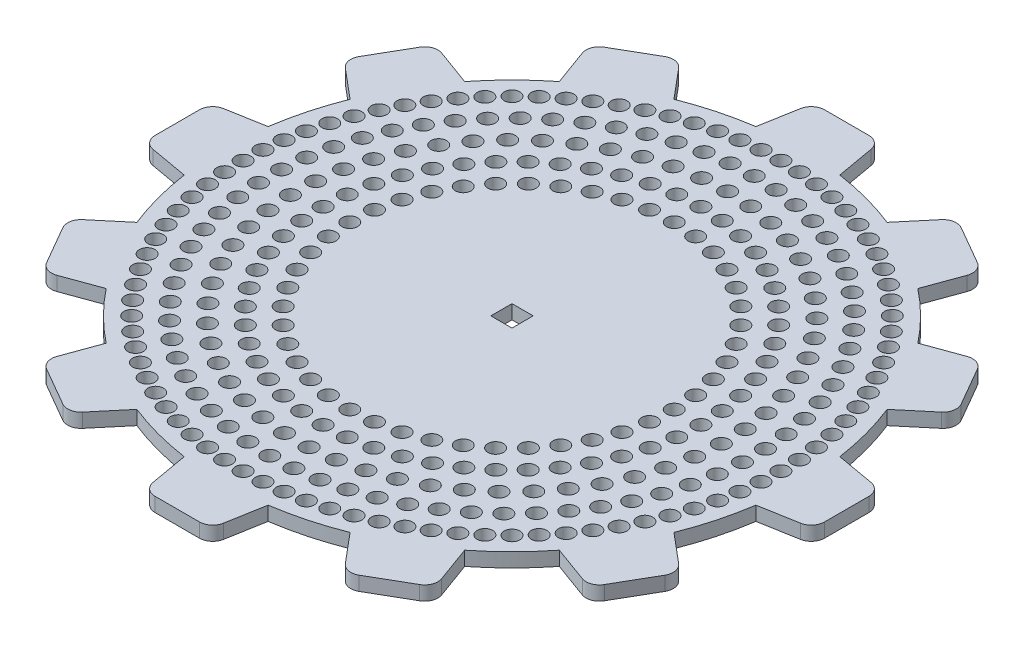
from build123d import *

# Parameters (mm, degrees)
SKETCH1_R           = 130
SKETCH1_R_2         = 3.5
SKETCH1_W           = 9.525
SKETCH1_H           = 9.525
BOSS_EXTRUDE1_DEPTH = 6.35
BOSS_EXTRUDE2_START = -6.35
BOSS_EXTRUDE2_DEPTH = 6.35
FILLET3_R           = 6
FILLET4_R           = 6


with BuildPart() as part:
    # Sketch1 → Boss-Extrude1 (new body)
    with BuildSketch(Plane(origin=(0, 0, 0), x_dir=(1, 0, 0), z_dir=(0, 1, 0))):
        with Locations(Location((0, 0, 0), (0, 0, 270))):
            Circle(SKETCH1_R)
        with Locations(Location((0, 73, 0), (0, 0, 270))):
            Circle(SKETCH1_R_2, mode=Mode.SUBTRACT)
        with Locations(Location((0, 85, 0), (0, 0, 270))):
            Circle(SKETCH1_R_2, mode=Mode.SUBTRACT)
        with Locations(Location((0, 97, 0), (0, 0, 270))):
            Circle(SKETCH1_R_2, mode=Mode.SUBTRACT)
        with Locations(Location((0, 109, 0), (0, 0, 270))):
            Circle(SKETCH1_R_2, mode=Mode.SUBTRACT)
        with Locations(Location((10.36110872, 108.50643956, 0), (0, 0, 270))):
            Circle(SKETCH1_R_2, mode=Mode.SUBTRACT)
        with Locations(Location((20.628385635, 107.030228002, 0), (0, 0, 270))):
            Circle(SKETCH1_R_2, mode=Mode.SUBTRACT)
        with Locations(Location((30.708848696, 104.584734124, 0), (0, 0, 270))):
            Circle(SKETCH1_R_2, mode=Mode.SUBTRACT)
        with Locations(Location((40.511207667, 101.192104699, 0), (0, 0, 270))):
            Circle(SKETCH1_R_2, mode=Mode.SUBTRACT)
        with Locations(Location((49.946690868, 96.883063903, 0), (0, 0, 270))):
            Circle(SKETCH1_R_2, mode=Mode.SUBTRACT)
        with Locations(Location((58.929849103, 91.696635079, 0), (0, 0, 270))):
            Circle(SKETCH1_R_2, mode=Mode.SUBTRACT)
        with Locations(Location((67.379329498, 85.679787327, 0), (0, 0, 270))):
            Circle(SKETCH1_R_2, mode=Mode.SUBTRACT)
        with Locations(Location((75.218612252, 78.887010153, 0), (0, 0, 270))):
            Circle(SKETCH1_R_2, mode=Mode.SUBTRACT)
        with Locations(Location((82.376703605, 71.37982, 0), (0, 0, 270))):
            Circle(SKETCH1_R_2, mode=Mode.SUBTRACT)
        with Locations(Location((88.788778773, 63.226203143, 0), (0, 0, 270))):
            Circle(SKETCH1_R_2, mode=Mode.SUBTRACT)
        with Locations(Location((94.396769013, 54.5, 0), (0, 0, 270))):
            Circle(SKETCH1_R_2, mode=Mode.SUBTRACT)
        with Locations(Location((99.149887494, 45.280236417, 0), (0, 0, 270))):
            Circle(SKETCH1_R_2, mode=Mode.SUBTRACT)
        with Locations(Location((103.00508924, 35.650408002, 0), (0, 0, 270))):
            Circle(SKETCH1_R_2, mode=Mode.SUBTRACT)
        with Locations(Location((105.927460947, 25.697723971, 0), (0, 0, 270))):
            Circle(SKETCH1_R_2, mode=Mode.SUBTRACT)
        with Locations(Location((107.890537165, 15.512317372, 0), (0, 0, 270))):
            Circle(SKETCH1_R_2, mode=Mode.SUBTRACT)
        with Locations(Location((108.876539971, 5.186428825, 0), (0, 0, 270))):
            Circle(SKETCH1_R_2, mode=Mode.SUBTRACT)
        with Locations(Location((108.876539971, -5.186428825, 0), (0, 0, 270))):
            Circle(SKETCH1_R_2, mode=Mode.SUBTRACT)
        with Locations(Location((107.890537165, -15.512317372, 0), (0, 0, 270))):
            Circle(SKETCH1_R_2, mode=Mode.SUBTRACT)
        with Locations(Location((105.927460947, -25.697723971, 0), (0, 0, 270))):
            Circle(SKETCH1_R_2, mode=Mode.SUBTRACT)
        with Locations(Location((103.00508924, -35.650408002, 0), (0, 0, 270))):
            Circle(SKETCH1_R_2, mode=Mode.SUBTRACT)
        with Locations(Location((99.149887494, -45.280236417, 0), (0, 0, 270))):
            Circle(SKETCH1_R_2, mode=Mode.SUBTRACT)
        with Locations(Location((94.396769013, -54.5, 0), (0, 0, 270))):
            Circle(SKETCH1_R_2, mode=Mode.SUBTRACT)
        with Locations(Location((88.788778774, -63.226203143, 0), (0, 0, 270))):
            Circle(SKETCH1_R_2, mode=Mode.SUBTRACT)
        with Locations(Location((82.376703605, -71.37982, 0), (0, 0, 270))):
            Circle(SKETCH1_R_2, mode=Mode.SUBTRACT)
        with Locations(Location((75.218612252, -78.887010153, 0), (0, 0, 270))):
            Circle(SKETCH1_R_2, mode=Mode.SUBTRACT)
        with Locations(Location((67.379329498, -85.679787327, 0), (0, 0, 270))):
            Circle(SKETCH1_R_2, mode=Mode.SUBTRACT)
        with Locations(Location((58.929849103, -91.696635079, 0), (0, 0, 270))):
            Circle(SKETCH1_R_2, mode=Mode.SUBTRACT)
        with Locations(Location((49.946690868, -96.883063903, 0), (0, 0, 270))):
            Circle(SKETCH1_R_2, mode=Mode.SUBTRACT)
        with Locations(Location((40.511207667, -101.192104699, 0), (0, 0, 270))):
            Circle(SKETCH1_R_2, mode=Mode.SUBTRACT)
        with Locations(Location((30.708848696, -104.584734124, 0), (0, 0, 270))):
            Circle(SKETCH1_R_2, mode=Mode.SUBTRACT)
        with Locations(Location((20.628385635, -107.030228002, 0), (0, 0, 270))):
            Circle(SKETCH1_R_2, mode=Mode.SUBTRACT)
        with Locations(Location((10.36110872, -108.50643956, 0), (0, 0, 270))):
            Circle(SKETCH1_R_2, mode=Mode.SUBTRACT)
        with Locations(Location((0, -109, 0), (0, 0, 270))):
            Circle(SKETCH1_R_2, mode=Mode.SUBTRACT)
        with Locations(Location((-10.36110872, -108.50643956, 0), (0, 0, 270))):
            Circle(SKETCH1_R_2, mode=Mode.SUBTRACT)
        with Locations(Location((-20.628385635, -107.030228002, 0), (0, 0, 270))):
            Circle(SKETCH1_R_2, mode=Mode.SUBTRACT)
        with Locations(Location((-30.708848696, -104.584734124, 0), (0, 0, 270))):
            Circle(SKETCH1_R_2, mode=Mode.SUBTRACT)
        with Locations(Location((-40.511207667, -101.192104699, 0), (0, 0, 270))):
            Circle(SKETCH1_R_2, mode=Mode.SUBTRACT)
        with Locations(Location((-49.946690868, -96.883063903, 0), (0, 0, 270))):
            Circle(SKETCH1_R_2, mode=Mode.SUBTRACT)
        with Locations(Location((-58.929849103, -91.696635079, 0), (0, 0, 270))):
            Circle(SKETCH1_R_2, mode=Mode.SUBTRACT)
        with Locations(Location((-67.379329498, -85.679787327, 0), (0, 0, 270))):
            Circle(SKETCH1_R_2, mode=Mode.SUBTRACT)
        with Locations(Location((-75.218612252, -78.887010153, 0), (0, 0, 270))):
            Circle(SKETCH1_R_2, mode=Mode.SUBTRACT)
        with Locations(Location((-82.376703605, -71.37982, 0), (0, 0, 270))):
            Circle(SKETCH1_R_2, mode=Mode.SUBTRACT)
        with Locations(Location((-88.788778773, -63.226203143, 0), (0, 0, 270))):
            Circle(SKETCH1_R_2, mode=Mode.SUBTRACT)
        with Locations(Location((-94.396769012, -54.5, 0), (0, 0, 270))):
            Circle(SKETCH1_R_2, mode=Mode.SUBTRACT)
        with Locations(Location((-99.149887494, -45.280236417, 0), (0, 0, 270))):
            Circle(SKETCH1_R_2, mode=Mode.SUBTRACT)
        with Locations(Location((-103.00508924, -35.650408002, 0), (0, 0, 270))):
            Circle(SKETCH1_R_2, mode=Mode.SUBTRACT)
        with Locations(Location((-105.927460947, -25.697723971, 0), (0, 0, 270))):
            Circle(SKETCH1_R_2, mode=Mode.SUBTRACT)
        with Locations(Location((-107.890537165, -15.512317372, 0), (0, 0, 270))):
            Circle(SKETCH1_R_2, mode=Mode.SUBTRACT)
        with Locations(Location((-108.876539971, -5.186428825, 0), (0, 0, 270))):
            Circle(SKETCH1_R_2, mode=Mode.SUBTRACT)
        with Locations(Location((-108.876539971, 5.186428825, 0), (0, 0, 270))):
            Circle(SKETCH1_R_2, mode=Mode.SUBTRACT)
        with Locations(Location((-107.890537165, 15.512317372, 0), (0, 0, 270))):
            Circle(SKETCH1_R_2, mode=Mode.SUBTRACT)
        with Locations(Location((-105.927460947, 25.697723971, 0), (0, 0, 270))):
            Circle(SKETCH1_R_2, mode=Mode.SUBTRACT)
        with Locations(Location((-103.00508924, 35.650408002, 0), (0, 0, 270))):
            Circle(SKETCH1_R_2, mode=Mode.SUBTRACT)
        with Locations(Location((-99.149887494, 45.280236417, 0), (0, 0, 270))):
            Circle(SKETCH1_R_2, mode=Mode.SUBTRACT)
        with Locations(Location((-94.396769012, 54.5, 0), (0, 0, 270))):
            Circle(SKETCH1_R_2, mode=Mode.SUBTRACT)
        with Locations(Location((-88.788778773, 63.226203143, 0), (0, 0, 270))):
            Circle(SKETCH1_R_2, mode=Mode.SUBTRACT)
        with Locations(Location((-82.376703605, 71.37982, 0), (0, 0, 270))):
            Circle(SKETCH1_R_2, mode=Mode.SUBTRACT)
        with Locations(Location((-75.218612252, 78.887010153, 0), (0, 0, 270))):
            Circle(SKETCH1_R_2, mode=Mode.SUBTRACT)
        with Locations(Location((-67.379329498, 85.679787327, 0), (0, 0, 270))):
            Circle(SKETCH1_R_2, mode=Mode.SUBTRACT)
        with Locations(Location((-58.929849103, 91.696635079, 0), (0, 0, 270))):
            Circle(SKETCH1_R_2, mode=Mode.SUBTRACT)
        with Locations(Location((-49.946690868, 96.883063903, 0), (0, 0, 270))):
            Circle(SKETCH1_R_2, mode=Mode.SUBTRACT)
        with Locations(Location((-40.511207667, 101.192104699, 0), (0, 0, 270))):
            Circle(SKETCH1_R_2, mode=Mode.SUBTRACT)
        with Locations(Location((-30.708848696, 104.584734124, 0), (0, 0, 270))):
            Circle(SKETCH1_R_2, mode=Mode.SUBTRACT)
        with Locations(Location((-20.628385635, 107.030228002, 0), (0, 0, 270))):
            Circle(SKETCH1_R_2, mode=Mode.SUBTRACT)
        with Locations(Location((-10.36110872, 108.50643956, 0), (0, 0, 270))):
            Circle(SKETCH1_R_2, mode=Mode.SUBTRACT)
        with Locations(Location((11.057166759, 96.367728329, 0), (0, 0, 270))):
            Circle(SKETCH1_R_2, mode=Mode.SUBTRACT)
        with Locations(Location((21.97018644, 94.479155943, 0), (0, 0, 270))):
            Circle(SKETCH1_R_2, mode=Mode.SUBTRACT)
        with Locations(Location((32.596791142, 91.358903273, 0), (0, 0, 270))):
            Circle(SKETCH1_R_2, mode=Mode.SUBTRACT)
        with Locations(Location((42.798446821, 87.047647583, 0), (0, 0, 270))):
            Circle(SKETCH1_R_2, mode=Mode.SUBTRACT)
        with Locations(Location((52.442159293, 81.601592685, 0), (0, 0, 270))):
            Circle(SKETCH1_R_2, mode=Mode.SUBTRACT)
        with Locations(Location((61.402208019, 75.091736232, 0), (0, 0, 270))):
            Circle(SKETCH1_R_2, mode=Mode.SUBTRACT)
        with Locations(Location((69.561785062, 67.60294416, 0), (0, 0, 270))):
            Circle(SKETCH1_R_2, mode=Mode.SUBTRACT)
        with Locations(Location((76.814517854, 59.232844325, 0), (0, 0, 270))):
            Circle(SKETCH1_R_2, mode=Mode.SUBTRACT)
        with Locations(Location((83.065855934, 50.090553779, 0), (0, 0, 270))):
            Circle(SKETCH1_R_2, mode=Mode.SUBTRACT)
        with Locations(Location((88.234303549, 40.295256261, 0), (0, 0, 270))):
            Circle(SKETCH1_R_2, mode=Mode.SUBTRACT)
        with Locations(Location((92.252482081, 29.974648454, 0), (0, 0, 270))):
            Circle(SKETCH1_R_2, mode=Mode.SUBTRACT)
        with Locations(Location((95.068008426, 19.263275265, 0), (0, 0, 270))):
            Circle(SKETCH1_R_2, mode=Mode.SUBTRACT)
        with Locations(Location((96.644177894, 8.300775822, 0), (0, 0, 270))):
            Circle(SKETCH1_R_2, mode=Mode.SUBTRACT)
        with Locations(Location((96.960442704, -2.769936927, 0), (0, 0, 270))):
            Circle(SKETCH1_R_2, mode=Mode.SUBTRACT)
        with Locations(Location((96.012679862, -13.804539313, 0), (0, 0, 270))):
            Circle(SKETCH1_R_2, mode=Mode.SUBTRACT)
        with Locations(Location((93.813244906, -24.659178417, 0), (0, 0, 270))):
            Circle(SKETCH1_R_2, mode=Mode.SUBTRACT)
        with Locations(Location((90.390810834, -35.192347419, 0), (0, 0, 270))):
            Circle(SKETCH1_R_2, mode=Mode.SUBTRACT)
        with Locations(Location((85.789994307, -45.266730353, 0), (0, 0, 270))):
            Circle(SKETCH1_R_2, mode=Mode.SUBTRACT)
        with Locations(Location((80.070774005, -54.75099223, 0), (0, 0, 270))):
            Circle(SKETCH1_R_2, mode=Mode.SUBTRACT)
        with Locations(Location((73.307708712, -63.521491193, 0), (0, 0, 270))):
            Circle(SKETCH1_R_2, mode=Mode.SUBTRACT)
        with Locations(Location((65.588965327, -71.463890374, 0), (0, 0, 270))):
            Circle(SKETCH1_R_2, mode=Mode.SUBTRACT)
        with Locations(Location((57.015169472, -78.474648454, 0), (0, 0, 270))):
            Circle(SKETCH1_R_2, mode=Mode.SUBTRACT)
        with Locations(Location((47.698093691, -84.462369481, 0), (0, 0, 270))):
            Circle(SKETCH1_R_2, mode=Mode.SUBTRACT)
        with Locations(Location((37.759200313, -89.348994352, 0), (0, 0, 270))):
            Circle(SKETCH1_R_2, mode=Mode.SUBTRACT)
        with Locations(Location((27.328058014, -93.070818441, 0), (0, 0, 270))):
            Circle(SKETCH1_R_2, mode=Mode.SUBTRACT)
        with Locations(Location((16.540652685, -95.579322077, 0), (0, 0, 270))):
            Circle(SKETCH1_R_2, mode=Mode.SUBTRACT)
        with Locations(Location((5.537614654, -96.841803081, 0), (0, 0, 270))):
            Circle(SKETCH1_R_2, mode=Mode.SUBTRACT)
        with Locations(Location((-5.537614654, -96.841803081, 0), (0, 0, 270))):
            Circle(SKETCH1_R_2, mode=Mode.SUBTRACT)
        with Locations(Location((-16.540652685, -95.579322077, 0), (0, 0, 270))):
            Circle(SKETCH1_R_2, mode=Mode.SUBTRACT)
        with Locations(Location((-27.328058014, -93.070818441, 0), (0, 0, 270))):
            Circle(SKETCH1_R_2, mode=Mode.SUBTRACT)
        with Locations(Location((-37.759200313, -89.348994352, 0), (0, 0, 270))):
            Circle(SKETCH1_R_2, mode=Mode.SUBTRACT)
        with Locations(Location((-47.698093691, -84.462369481, 0), (0, 0, 270))):
            Circle(SKETCH1_R_2, mode=Mode.SUBTRACT)
        with Locations(Location((-57.015169472, -78.474648454, 0), (0, 0, 270))):
            Circle(SKETCH1_R_2, mode=Mode.SUBTRACT)
        with Locations(Location((-65.588965327, -71.463890374, 0), (0, 0, 270))):
            Circle(SKETCH1_R_2, mode=Mode.SUBTRACT)
        with Locations(Location((-73.307708712, -63.521491193, 0), (0, 0, 270))):
            Circle(SKETCH1_R_2, mode=Mode.SUBTRACT)
        with Locations(Location((-80.070774005, -54.75099223, 0), (0, 0, 270))):
            Circle(SKETCH1_R_2, mode=Mode.SUBTRACT)
        with Locations(Location((-85.789994307, -45.266730353, 0), (0, 0, 270))):
            Circle(SKETCH1_R_2, mode=Mode.SUBTRACT)
        with Locations(Location((-90.390810833, -35.192347419, 0), (0, 0, 270))):
            Circle(SKETCH1_R_2, mode=Mode.SUBTRACT)
        with Locations(Location((-93.813244906, -24.659178417, 0), (0, 0, 270))):
            Circle(SKETCH1_R_2, mode=Mode.SUBTRACT)
        with Locations(Location((-96.012679862, -13.804539313, 0), (0, 0, 270))):
            Circle(SKETCH1_R_2, mode=Mode.SUBTRACT)
        with Locations(Location((-96.960442704, -2.769936927, 0), (0, 0, 270))):
            Circle(SKETCH1_R_2, mode=Mode.SUBTRACT)
        with Locations(Location((-96.644177894, 8.300775822, 0), (0, 0, 270))):
            Circle(SKETCH1_R_2, mode=Mode.SUBTRACT)
        with Locations(Location((-95.068008426, 19.263275265, 0), (0, 0, 270))):
            Circle(SKETCH1_R_2, mode=Mode.SUBTRACT)
        with Locations(Location((-92.252482081, 29.974648454, 0), (0, 0, 270))):
            Circle(SKETCH1_R_2, mode=Mode.SUBTRACT)
        with Locations(Location((-88.234303549, 40.295256261, 0), (0, 0, 270))):
            Circle(SKETCH1_R_2, mode=Mode.SUBTRACT)
        with Locations(Location((-83.065855934, 50.090553779, 0), (0, 0, 270))):
            Circle(SKETCH1_R_2, mode=Mode.SUBTRACT)
        with Locations(Location((-76.814517854, 59.232844325, 0), (0, 0, 270))):
            Circle(SKETCH1_R_2, mode=Mode.SUBTRACT)
        with Locations(Location((-69.561785062, 67.60294416, 0), (0, 0, 270))):
            Circle(SKETCH1_R_2, mode=Mode.SUBTRACT)
        with Locations(Location((-61.402208019, 75.091736232, 0), (0, 0, 270))):
            Circle(SKETCH1_R_2, mode=Mode.SUBTRACT)
        with Locations(Location((-52.442159293, 81.601592685, 0), (0, 0, 270))):
            Circle(SKETCH1_R_2, mode=Mode.SUBTRACT)
        with Locations(Location((-42.798446821, 87.047647583, 0), (0, 0, 270))):
            Circle(SKETCH1_R_2, mode=Mode.SUBTRACT)
        with Locations(Location((-32.596791142, 91.358903273, 0), (0, 0, 270))):
            Circle(SKETCH1_R_2, mode=Mode.SUBTRACT)
        with Locations(Location((-21.97018644, 94.479155943, 0), (0, 0, 270))):
            Circle(SKETCH1_R_2, mode=Mode.SUBTRACT)
        with Locations(Location((-11.057166759, 96.367728329, 0), (0, 0, 270))):
            Circle(SKETCH1_R_2, mode=Mode.SUBTRACT)
        with Locations(Location((10.245617822, 84.380254298, 0), (0, 0, 270))):
            Circle(SKETCH1_R_2, mode=Mode.SUBTRACT)
        with Locations(Location((20.341831464, 82.530054481, 0), (0, 0, 270))):
            Circle(SKETCH1_R_2, mode=Mode.SUBTRACT)
        with Locations(Location((30.141415399, 79.476380628, 0), (0, 0, 270))):
            Circle(SKETCH1_R_2, mode=Mode.SUBTRACT)
        with Locations(Location((39.501469624, 75.263762181, 0), (0, 0, 270))):
            Circle(SKETCH1_R_2, mode=Mode.SUBTRACT)
        with Locations(Location((48.285503472, 69.953628601, 0), (0, 0, 270))):
            Circle(SKETCH1_R_2, mode=Mode.SUBTRACT)
        with Locations(Location((56.36542595, 63.623413595, 0), (0, 0, 270))):
            Circle(SKETCH1_R_2, mode=Mode.SUBTRACT)
        with Locations(Location((63.623413595, 56.36542595, 0), (0, 0, 270))):
            Circle(SKETCH1_R_2, mode=Mode.SUBTRACT)
        with Locations(Location((69.953628601, 48.285503472, 0), (0, 0, 270))):
            Circle(SKETCH1_R_2, mode=Mode.SUBTRACT)
        with Locations(Location((75.263762181, 39.501469624, 0), (0, 0, 270))):
            Circle(SKETCH1_R_2, mode=Mode.SUBTRACT)
        with Locations(Location((79.476380628, 30.141415399, 0), (0, 0, 270))):
            Circle(SKETCH1_R_2, mode=Mode.SUBTRACT)
        with Locations(Location((82.530054481, 20.341831464, 0), (0, 0, 270))):
            Circle(SKETCH1_R_2, mode=Mode.SUBTRACT)
        with Locations(Location((84.380254298, 10.245617822, 0), (0, 0, 270))):
            Circle(SKETCH1_R_2, mode=Mode.SUBTRACT)
        with Locations(Location((85, 0, 0), (0, 0, 270))):
            Circle(SKETCH1_R_2, mode=Mode.SUBTRACT)
        with Locations(Location((84.380254298, -10.245617822, 0), (0, 0, 270))):
            Circle(SKETCH1_R_2, mode=Mode.SUBTRACT)
        with Locations(Location((82.530054481, -20.341831464, 0), (0, 0, 270))):
            Circle(SKETCH1_R_2, mode=Mode.SUBTRACT)
        with Locations(Location((79.476380628, -30.141415399, 0), (0, 0, 270))):
            Circle(SKETCH1_R_2, mode=Mode.SUBTRACT)
        with Locations(Location((75.263762181, -39.501469624, 0), (0, 0, 270))):
            Circle(SKETCH1_R_2, mode=Mode.SUBTRACT)
        with Locations(Location((69.953628601, -48.285503472, 0), (0, 0, 270))):
            Circle(SKETCH1_R_2, mode=Mode.SUBTRACT)
        with Locations(Location((63.623413595, -56.36542595, 0), (0, 0, 270))):
            Circle(SKETCH1_R_2, mode=Mode.SUBTRACT)
        with Locations(Location((56.36542595, -63.623413595, 0), (0, 0, 270))):
            Circle(SKETCH1_R_2, mode=Mode.SUBTRACT)
        with Locations(Location((48.285503472, -69.953628601, 0), (0, 0, 270))):
            Circle(SKETCH1_R_2, mode=Mode.SUBTRACT)
        with Locations(Location((39.501469624, -75.263762181, 0), (0, 0, 270))):
            Circle(SKETCH1_R_2, mode=Mode.SUBTRACT)
        with Locations(Location((30.141415399, -79.476380628, 0), (0, 0, 270))):
            Circle(SKETCH1_R_2, mode=Mode.SUBTRACT)
        with Locations(Location((20.341831464, -82.530054481, 0), (0, 0, 270))):
            Circle(SKETCH1_R_2, mode=Mode.SUBTRACT)
        with Locations(Location((10.245617822, -84.380254298, 0), (0, 0, 270))):
            Circle(SKETCH1_R_2, mode=Mode.SUBTRACT)
        with Locations(Location((0, -85, 0), (0, 0, 270))):
            Circle(SKETCH1_R_2, mode=Mode.SUBTRACT)
        with Locations(Location((-10.245617822, -84.380254298, 0), (0, 0, 270))):
            Circle(SKETCH1_R_2, mode=Mode.SUBTRACT)
        with Locations(Location((-20.341831464, -82.530054481, 0), (0, 0, 270))):
            Circle(SKETCH1_R_2, mode=Mode.SUBTRACT)
        with Locations(Location((-30.141415399, -79.476380628, 0), (0, 0, 270))):
            Circle(SKETCH1_R_2, mode=Mode.SUBTRACT)
        with Locations(Location((-39.501469624, -75.263762181, 0), (0, 0, 270))):
            Circle(SKETCH1_R_2, mode=Mode.SUBTRACT)
        with Locations(Location((-48.285503472, -69.953628601, 0), (0, 0, 270))):
            Circle(SKETCH1_R_2, mode=Mode.SUBTRACT)
        with Locations(Location((-56.36542595, -63.623413595, 0), (0, 0, 270))):
            Circle(SKETCH1_R_2, mode=Mode.SUBTRACT)
        with Locations(Location((-63.623413595, -56.36542595, 0), (0, 0, 270))):
            Circle(SKETCH1_R_2, mode=Mode.SUBTRACT)
        with Locations(Location((-69.953628601, -48.285503472, 0), (0, 0, 270))):
            Circle(SKETCH1_R_2, mode=Mode.SUBTRACT)
        with Locations(Location((-75.263762181, -39.501469624, 0), (0, 0, 270))):
            Circle(SKETCH1_R_2, mode=Mode.SUBTRACT)
        with Locations(Location((-79.476380628, -30.141415399, 0), (0, 0, 270))):
            Circle(SKETCH1_R_2, mode=Mode.SUBTRACT)
        with Locations(Location((-82.530054481, -20.341831464, 0), (0, 0, 270))):
            Circle(SKETCH1_R_2, mode=Mode.SUBTRACT)
        with Locations(Location((-84.380254298, -10.245617822, 0), (0, 0, 270))):
            Circle(SKETCH1_R_2, mode=Mode.SUBTRACT)
        with Locations(Location((-85, 0, 0), (0, 0, 270))):
            Circle(SKETCH1_R_2, mode=Mode.SUBTRACT)
        with Locations(Location((-84.380254298, 10.245617822, 0), (0, 0, 270))):
            Circle(SKETCH1_R_2, mode=Mode.SUBTRACT)
        with Locations(Location((-82.530054481, 20.341831464, 0), (0, 0, 270))):
            Circle(SKETCH1_R_2, mode=Mode.SUBTRACT)
        with Locations(Location((-79.476380628, 30.141415399, 0), (0, 0, 270))):
            Circle(SKETCH1_R_2, mode=Mode.SUBTRACT)
        with Locations(Location((-75.263762181, 39.501469624, 0), (0, 0, 270))):
            Circle(SKETCH1_R_2, mode=Mode.SUBTRACT)
        with Locations(Location((-69.953628601, 48.285503472, 0), (0, 0, 270))):
            Circle(SKETCH1_R_2, mode=Mode.SUBTRACT)
        with Locations(Location((-63.623413595, 56.36542595, 0), (0, 0, 270))):
            Circle(SKETCH1_R_2, mode=Mode.SUBTRACT)
        with Locations(Location((-56.36542595, 63.623413595, 0), (0, 0, 270))):
            Circle(SKETCH1_R_2, mode=Mode.SUBTRACT)
        with Locations(Location((-48.285503472, 69.953628601, 0), (0, 0, 270))):
            Circle(SKETCH1_R_2, mode=Mode.SUBTRACT)
        with Locations(Location((-39.501469624, 75.263762181, 0), (0, 0, 270))):
            Circle(SKETCH1_R_2, mode=Mode.SUBTRACT)
        with Locations(Location((-30.141415399, 79.476380628, 0), (0, 0, 270))):
            Circle(SKETCH1_R_2, mode=Mode.SUBTRACT)
        with Locations(Location((-20.341831464, 82.530054481, 0), (0, 0, 270))):
            Circle(SKETCH1_R_2, mode=Mode.SUBTRACT)
        with Locations(Location((-10.245617822, 84.380254298, 0), (0, 0, 270))):
            Circle(SKETCH1_R_2, mode=Mode.SUBTRACT)
        with Locations(Location((10.388983194, 72.256965257, 0), (0, 0, 270))):
            Circle(SKETCH1_R_2, mode=Mode.SUBTRACT)
        with Locations(Location((20.566476649, 70.042987074, 0), (0, 0, 270))):
            Circle(SKETCH1_R_2, mode=Mode.SUBTRACT)
        with Locations(Location((30.325295949, 66.403135661, 0), (0, 0, 270))):
            Circle(SKETCH1_R_2, mode=Mode.SUBTRACT)
        with Locations(Location((39.466779674, 61.411507897, 0), (0, 0, 270))):
            Circle(SKETCH1_R_2, mode=Mode.SUBTRACT)
        with Locations(Location((47.804833578, 55.169718928, 0), (0, 0, 270))):
            Circle(SKETCH1_R_2, mode=Mode.SUBTRACT)
        with Locations(Location((55.169718928, 47.804833578, 0), (0, 0, 270))):
            Circle(SKETCH1_R_2, mode=Mode.SUBTRACT)
        with Locations(Location((61.411507897, 39.466779674, 0), (0, 0, 270))):
            Circle(SKETCH1_R_2, mode=Mode.SUBTRACT)
        with Locations(Location((66.403135661, 30.325295949, 0), (0, 0, 270))):
            Circle(SKETCH1_R_2, mode=Mode.SUBTRACT)
        with Locations(Location((70.042987074, 20.566476649, 0), (0, 0, 270))):
            Circle(SKETCH1_R_2, mode=Mode.SUBTRACT)
        with Locations(Location((72.256965257, 10.388983194, 0), (0, 0, 270))):
            Circle(SKETCH1_R_2, mode=Mode.SUBTRACT)
        with Locations(Location((73, 0, 0), (0, 0, 270))):
            Circle(SKETCH1_R_2, mode=Mode.SUBTRACT)
        with Locations(Location((72.256965257, -10.388983194, 0), (0, 0, 270))):
            Circle(SKETCH1_R_2, mode=Mode.SUBTRACT)
        with Locations(Location((70.042987074, -20.566476649, 0), (0, 0, 270))):
            Circle(SKETCH1_R_2, mode=Mode.SUBTRACT)
        with Locations(Location((66.403135661, -30.325295949, 0), (0, 0, 270))):
            Circle(SKETCH1_R_2, mode=Mode.SUBTRACT)
        with Locations(Location((61.411507897, -39.466779674, 0), (0, 0, 270))):
            Circle(SKETCH1_R_2, mode=Mode.SUBTRACT)
        with Locations(Location((55.169718928, -47.804833578, 0), (0, 0, 270))):
            Circle(SKETCH1_R_2, mode=Mode.SUBTRACT)
        with Locations(Location((47.804833578, -55.169718928, 0), (0, 0, 270))):
            Circle(SKETCH1_R_2, mode=Mode.SUBTRACT)
        with Locations(Location((39.466779674, -61.411507897, 0), (0, 0, 270))):
            Circle(SKETCH1_R_2, mode=Mode.SUBTRACT)
        with Locations(Location((30.325295949, -66.403135661, 0), (0, 0, 270))):
            Circle(SKETCH1_R_2, mode=Mode.SUBTRACT)
        with Locations(Location((20.566476649, -70.042987074, 0), (0, 0, 270))):
            Circle(SKETCH1_R_2, mode=Mode.SUBTRACT)
        with Locations(Location((10.388983194, -72.256965257, 0), (0, 0, 270))):
            Circle(SKETCH1_R_2, mode=Mode.SUBTRACT)
        with Locations(Location((0, -73, 0), (0, 0, 270))):
            Circle(SKETCH1_R_2, mode=Mode.SUBTRACT)
        with Locations(Location((-10.388983194, -72.256965257, 0), (0, 0, 270))):
            Circle(SKETCH1_R_2, mode=Mode.SUBTRACT)
        with Locations(Location((-20.566476649, -70.042987074, 0), (0, 0, 270))):
            Circle(SKETCH1_R_2, mode=Mode.SUBTRACT)
        with Locations(Location((-30.325295949, -66.403135661, 0), (0, 0, 270))):
            Circle(SKETCH1_R_2, mode=Mode.SUBTRACT)
        with Locations(Location((-39.466779674, -61.411507897, 0), (0, 0, 270))):
            Circle(SKETCH1_R_2, mode=Mode.SUBTRACT)
        with Locations(Location((-47.804833578, -55.169718928, 0), (0, 0, 270))):
            Circle(SKETCH1_R_2, mode=Mode.SUBTRACT)
        with Locations(Location((-55.169718928, -47.804833578, 0), (0, 0, 270))):
            Circle(SKETCH1_R_2, mode=Mode.SUBTRACT)
        with Locations(Location((-61.411507897, -39.466779674, 0), (0, 0, 270))):
            Circle(SKETCH1_R_2, mode=Mode.SUBTRACT)
        with Locations(Location((-66.403135661, -30.325295949, 0), (0, 0, 270))):
            Circle(SKETCH1_R_2, mode=Mode.SUBTRACT)
        with Locations(Location((-70.042987074, -20.566476649, 0), (0, 0, 270))):
            Circle(SKETCH1_R_2, mode=Mode.SUBTRACT)
        with Locations(Location((-72.256965257, -10.388983194, 0), (0, 0, 270))):
            Circle(SKETCH1_R_2, mode=Mode.SUBTRACT)
        with Locations(Location((-73, 0, 0), (0, 0, 270))):
            Circle(SKETCH1_R_2, mode=Mode.SUBTRACT)
        with Locations(Location((-72.256965257, 10.388983194, 0), (0, 0, 270))):
            Circle(SKETCH1_R_2, mode=Mode.SUBTRACT)
        with Locations(Location((-70.042987074, 20.566476649, 0), (0, 0, 270))):
            Circle(SKETCH1_R_2, mode=Mode.SUBTRACT)
        with Locations(Location((-66.403135661, 30.325295949, 0), (0, 0, 270))):
            Circle(SKETCH1_R_2, mode=Mode.SUBTRACT)
        with Locations(Location((-61.411507897, 39.466779674, 0), (0, 0, 270))):
            Circle(SKETCH1_R_2, mode=Mode.SUBTRACT)
        with Locations(Location((-55.169718928, 47.804833578, 0), (0, 0, 270))):
            Circle(SKETCH1_R_2, mode=Mode.SUBTRACT)
        with Locations(Location((-47.804833578, 55.169718928, 0), (0, 0, 270))):
            Circle(SKETCH1_R_2, mode=Mode.SUBTRACT)
        with Locations(Location((-39.466779674, 61.411507897, 0), (0, 0, 270))):
            Circle(SKETCH1_R_2, mode=Mode.SUBTRACT)
        with Locations(Location((-30.325295949, 66.403135661, 0), (0, 0, 270))):
            Circle(SKETCH1_R_2, mode=Mode.SUBTRACT)
        with Locations(Location((-20.566476649, 70.042987074, 0), (0, 0, 270))):
            Circle(SKETCH1_R_2, mode=Mode.SUBTRACT)
        with Locations(Location((-10.388983194, 72.256965257, 0), (0, 0, 270))):
            Circle(SKETCH1_R_2, mode=Mode.SUBTRACT)
        with Locations(Location((0, 121, 0), (0, 0, 270))):
            Circle(SKETCH1_R_2, mode=Mode.SUBTRACT)
        with Locations(Location((8.632041167, 120.691705868, 0), (0, 0, 270))):
            Circle(SKETCH1_R_2, mode=Mode.SUBTRACT)
        with Locations(Location((17.220095431, 119.768394468, 0), (0, 0, 270))):
            Circle(SKETCH1_R_2, mode=Mode.SUBTRACT)
        with Locations(Location((25.720400036, 118.234770783, 0), (0, 0, 270))):
            Circle(SKETCH1_R_2, mode=Mode.SUBTRACT)
        with Locations(Location((34.089639378, 116.098649807, 0), (0, 0, 270))):
            Circle(SKETCH1_R_2, mode=Mode.SUBTRACT)
        with Locations(Location((42.285165731, 113.370916725, 0), (0, 0, 270))):
            Circle(SKETCH1_R_2, mode=Mode.SUBTRACT)
        with Locations(Location((50.265216573, 110.065471438, 0), (0, 0, 270))):
            Circle(SKETCH1_R_2, mode=Mode.SUBTRACT)
        with Locations(Location((57.989127393, 106.199157738, 0), (0, 0, 270))):
            Circle(SKETCH1_R_2, mode=Mode.SUBTRACT)
        with Locations(Location((65.417538912, 101.791677473, 0), (0, 0, 270))):
            Circle(SKETCH1_R_2, mode=Mode.SUBTRACT)
        with Locations(Location((72.512597648, 96.865490152, 0), (0, 0, 270))):
            Circle(SKETCH1_R_2, mode=Mode.SUBTRACT)
        with Locations(Location((79.238148807, 91.445698497, 0), (0, 0, 270))):
            Circle(SKETCH1_R_2, mode=Mode.SUBTRACT)
        with Locations(Location((85.559920524, 85.559920524, 0), (0, 0, 270))):
            Circle(SKETCH1_R_2, mode=Mode.SUBTRACT)
        with Locations(Location((91.445698497, 79.238148807, 0), (0, 0, 270))):
            Circle(SKETCH1_R_2, mode=Mode.SUBTRACT)
        with Locations(Location((96.865490152, 72.512597648, 0), (0, 0, 270))):
            Circle(SKETCH1_R_2, mode=Mode.SUBTRACT)
        with Locations(Location((101.791677473, 65.417538912, 0), (0, 0, 270))):
            Circle(SKETCH1_R_2, mode=Mode.SUBTRACT)
        with Locations(Location((106.199157738, 57.989127393, 0), (0, 0, 270))):
            Circle(SKETCH1_R_2, mode=Mode.SUBTRACT)
        with Locations(Location((110.065471438, 50.265216573, 0), (0, 0, 270))):
            Circle(SKETCH1_R_2, mode=Mode.SUBTRACT)
        with Locations(Location((113.370916725, 42.285165731, 0), (0, 0, 270))):
            Circle(SKETCH1_R_2, mode=Mode.SUBTRACT)
        with Locations(Location((116.098649807, 34.089639378, 0), (0, 0, 270))):
            Circle(SKETCH1_R_2, mode=Mode.SUBTRACT)
        with Locations(Location((118.234770783, 25.720400036, 0), (0, 0, 270))):
            Circle(SKETCH1_R_2, mode=Mode.SUBTRACT)
        with Locations(Location((119.768394468, 17.220095431, 0), (0, 0, 270))):
            Circle(SKETCH1_R_2, mode=Mode.SUBTRACT)
        with Locations(Location((120.691705868, 8.632041167, 0), (0, 0, 270))):
            Circle(SKETCH1_R_2, mode=Mode.SUBTRACT)
        with Locations(Location((121, 0, 0), (0, 0, 270))):
            Circle(SKETCH1_R_2, mode=Mode.SUBTRACT)
        with Locations(Location((120.691705868, -8.632041167, 0), (0, 0, 270))):
            Circle(SKETCH1_R_2, mode=Mode.SUBTRACT)
        with Locations(Location((119.768394468, -17.220095431, 0), (0, 0, 270))):
            Circle(SKETCH1_R_2, mode=Mode.SUBTRACT)
        with Locations(Location((118.234770783, -25.720400036, 0), (0, 0, 270))):
            Circle(SKETCH1_R_2, mode=Mode.SUBTRACT)
        with Locations(Location((116.098649807, -34.089639378, 0), (0, 0, 270))):
            Circle(SKETCH1_R_2, mode=Mode.SUBTRACT)
        with Locations(Location((113.370916725, -42.285165731, 0), (0, 0, 270))):
            Circle(SKETCH1_R_2, mode=Mode.SUBTRACT)
        with Locations(Location((110.065471438, -50.265216573, 0), (0, 0, 270))):
            Circle(SKETCH1_R_2, mode=Mode.SUBTRACT)
        with Locations(Location((106.199157738, -57.989127393, 0), (0, 0, 270))):
            Circle(SKETCH1_R_2, mode=Mode.SUBTRACT)
        with Locations(Location((101.791677473, -65.417538912, 0), (0, 0, 270))):
            Circle(SKETCH1_R_2, mode=Mode.SUBTRACT)
        with Locations(Location((96.865490152, -72.512597648, 0), (0, 0, 270))):
            Circle(SKETCH1_R_2, mode=Mode.SUBTRACT)
        with Locations(Location((91.445698497, -79.238148807, 0), (0, 0, 270))):
            Circle(SKETCH1_R_2, mode=Mode.SUBTRACT)
        with Locations(Location((85.559920524, -85.559920524, 0), (0, 0, 270))):
            Circle(SKETCH1_R_2, mode=Mode.SUBTRACT)
        with Locations(Location((79.238148807, -91.445698497, 0), (0, 0, 270))):
            Circle(SKETCH1_R_2, mode=Mode.SUBTRACT)
        with Locations(Location((72.512597648, -96.865490152, 0), (0, 0, 270))):
            Circle(SKETCH1_R_2, mode=Mode.SUBTRACT)
        with Locations(Location((65.417538912, -101.791677473, 0), (0, 0, 270))):
            Circle(SKETCH1_R_2, mode=Mode.SUBTRACT)
        with Locations(Location((57.989127393, -106.199157738, 0), (0, 0, 270))):
            Circle(SKETCH1_R_2, mode=Mode.SUBTRACT)
        with Locations(Location((50.265216573, -110.065471438, 0), (0, 0, 270))):
            Circle(SKETCH1_R_2, mode=Mode.SUBTRACT)
        with Locations(Location((42.285165732, -113.370916725, 0), (0, 0, 270))):
            Circle(SKETCH1_R_2, mode=Mode.SUBTRACT)
        with Locations(Location((34.089639378, -116.098649807, 0), (0, 0, 270))):
            Circle(SKETCH1_R_2, mode=Mode.SUBTRACT)
        with Locations(Location((25.720400036, -118.234770783, 0), (0, 0, 270))):
            Circle(SKETCH1_R_2, mode=Mode.SUBTRACT)
        with Locations(Location((17.220095431, -119.768394468, 0), (0, 0, 270))):
            Circle(SKETCH1_R_2, mode=Mode.SUBTRACT)
        with Locations(Location((8.632041167, -120.691705868, 0), (0, 0, 270))):
            Circle(SKETCH1_R_2, mode=Mode.SUBTRACT)
        with Locations(Location((0, -121, 0), (0, 0, 270))):
            Circle(SKETCH1_R_2, mode=Mode.SUBTRACT)
        with Locations(Location((-8.632041167, -120.691705868, 0), (0, 0, 270))):
            Circle(SKETCH1_R_2, mode=Mode.SUBTRACT)
        with Locations(Location((-17.220095431, -119.768394468, 0), (0, 0, 270))):
            Circle(SKETCH1_R_2, mode=Mode.SUBTRACT)
        with Locations(Location((-25.720400036, -118.234770783, 0), (0, 0, 270))):
            Circle(SKETCH1_R_2, mode=Mode.SUBTRACT)
        with Locations(Location((-34.089639378, -116.098649807, 0), (0, 0, 270))):
            Circle(SKETCH1_R_2, mode=Mode.SUBTRACT)
        with Locations(Location((-42.285165731, -113.370916725, 0), (0, 0, 270))):
            Circle(SKETCH1_R_2, mode=Mode.SUBTRACT)
        with Locations(Location((-50.265216573, -110.065471438, 0), (0, 0, 270))):
            Circle(SKETCH1_R_2, mode=Mode.SUBTRACT)
        with Locations(Location((-57.989127393, -106.199157738, 0), (0, 0, 270))):
            Circle(SKETCH1_R_2, mode=Mode.SUBTRACT)
        with Locations(Location((-65.417538912, -101.791677473, 0), (0, 0, 270))):
            Circle(SKETCH1_R_2, mode=Mode.SUBTRACT)
        with Locations(Location((-72.512597648, -96.865490152, 0), (0, 0, 270))):
            Circle(SKETCH1_R_2, mode=Mode.SUBTRACT)
        with Locations(Location((-79.238148807, -91.445698497, 0), (0, 0, 270))):
            Circle(SKETCH1_R_2, mode=Mode.SUBTRACT)
        with Locations(Location((-85.559920524, -85.559920524, 0), (0, 0, 270))):
            Circle(SKETCH1_R_2, mode=Mode.SUBTRACT)
        with Locations(Location((-91.445698497, -79.238148807, 0), (0, 0, 270))):
            Circle(SKETCH1_R_2, mode=Mode.SUBTRACT)
        with Locations(Location((-96.865490152, -72.512597648, 0), (0, 0, 270))):
            Circle(SKETCH1_R_2, mode=Mode.SUBTRACT)
        with Locations(Location((-101.791677473, -65.417538912, 0), (0, 0, 270))):
            Circle(SKETCH1_R_2, mode=Mode.SUBTRACT)
        with Locations(Location((-106.199157738, -57.989127393, 0), (0, 0, 270))):
            Circle(SKETCH1_R_2, mode=Mode.SUBTRACT)
        with Locations(Location((-110.065471438, -50.265216573, 0), (0, 0, 270))):
            Circle(SKETCH1_R_2, mode=Mode.SUBTRACT)
        with Locations(Location((-113.370916725, -42.285165731, 0), (0, 0, 270))):
            Circle(SKETCH1_R_2, mode=Mode.SUBTRACT)
        with Locations(Location((-116.098649807, -34.089639378, 0), (0, 0, 270))):
            Circle(SKETCH1_R_2, mode=Mode.SUBTRACT)
        with Locations(Location((-118.234770783, -25.720400036, 0), (0, 0, 270))):
            Circle(SKETCH1_R_2, mode=Mode.SUBTRACT)
        with Locations(Location((-119.768394468, -17.220095431, 0), (0, 0, 270))):
            Circle(SKETCH1_R_2, mode=Mode.SUBTRACT)
        with Locations(Location((-120.691705868, -8.632041167, 0), (0, 0, 270))):
            Circle(SKETCH1_R_2, mode=Mode.SUBTRACT)
        with Locations(Location((-121, 0, 0), (0, 0, 270))):
            Circle(SKETCH1_R_2, mode=Mode.SUBTRACT)
        with Locations(Location((-120.691705868, 8.632041167, 0), (0, 0, 270))):
            Circle(SKETCH1_R_2, mode=Mode.SUBTRACT)
        with Locations(Location((-119.768394468, 17.220095431, 0), (0, 0, 270))):
            Circle(SKETCH1_R_2, mode=Mode.SUBTRACT)
        with Locations(Location((-118.234770783, 25.720400036, 0), (0, 0, 270))):
            Circle(SKETCH1_R_2, mode=Mode.SUBTRACT)
        with Locations(Location((-116.098649807, 34.089639378, 0), (0, 0, 270))):
            Circle(SKETCH1_R_2, mode=Mode.SUBTRACT)
        with Locations(Location((-113.370916725, 42.285165731, 0), (0, 0, 270))):
            Circle(SKETCH1_R_2, mode=Mode.SUBTRACT)
        with Locations(Location((-110.065471438, 50.265216573, 0), (0, 0, 270))):
            Circle(SKETCH1_R_2, mode=Mode.SUBTRACT)
        with Locations(Location((-106.199157738, 57.989127393, 0), (0, 0, 270))):
            Circle(SKETCH1_R_2, mode=Mode.SUBTRACT)
        with Locations(Location((-101.791677473, 65.417538912, 0), (0, 0, 270))):
            Circle(SKETCH1_R_2, mode=Mode.SUBTRACT)
        with Locations(Location((-96.865490152, 72.512597648, 0), (0, 0, 270))):
            Circle(SKETCH1_R_2, mode=Mode.SUBTRACT)
        with Locations(Location((-91.445698497, 79.238148807, 0), (0, 0, 270))):
            Circle(SKETCH1_R_2, mode=Mode.SUBTRACT)
        with Locations(Location((-85.559920524, 85.559920524, 0), (0, 0, 270))):
            Circle(SKETCH1_R_2, mode=Mode.SUBTRACT)
        with Locations(Location((-79.238148807, 91.445698497, 0), (0, 0, 270))):
            Circle(SKETCH1_R_2, mode=Mode.SUBTRACT)
        with Locations(Location((-72.512597648, 96.865490152, 0), (0, 0, 270))):
            Circle(SKETCH1_R_2, mode=Mode.SUBTRACT)
        with Locations(Location((-65.417538912, 101.791677473, 0), (0, 0, 270))):
            Circle(SKETCH1_R_2, mode=Mode.SUBTRACT)
        with Locations(Location((-57.989127393, 106.199157738, 0), (0, 0, 270))):
            Circle(SKETCH1_R_2, mode=Mode.SUBTRACT)
        with Locations(Location((-50.265216573, 110.065471438, 0), (0, 0, 270))):
            Circle(SKETCH1_R_2, mode=Mode.SUBTRACT)
        with Locations(Location((-42.285165731, 113.370916725, 0), (0, 0, 270))):
            Circle(SKETCH1_R_2, mode=Mode.SUBTRACT)
        with Locations(Location((-34.089639378, 116.098649807, 0), (0, 0, 270))):
            Circle(SKETCH1_R_2, mode=Mode.SUBTRACT)
        with Locations(Location((-25.720400036, 118.234770783, 0), (0, 0, 270))):
            Circle(SKETCH1_R_2, mode=Mode.SUBTRACT)
        with Locations(Location((-17.220095431, 119.768394468, 0), (0, 0, 270))):
            Circle(SKETCH1_R_2, mode=Mode.SUBTRACT)
        with Locations(Location((-8.632041167, 120.691705868, 0), (0, 0, 270))):
            Circle(SKETCH1_R_2, mode=Mode.SUBTRACT)
        Rectangle(SKETCH1_W, SKETCH1_H, mode=Mode.SUBTRACT)
    extrude(amount=BOSS_EXTRUDE1_DEPTH)

    # Sketch2 → Boss-Extrude2 (add)
    with BuildSketch(Plane(origin=(0, 6.35, 0), x_dir=(1, 0, 0), z_dir=(0, 1, 0)).offset(BOSS_EXTRUDE2_START)):
        with BuildLine():
            Line((0, 150.621833488), (15, 150.621833488))
            Line((15, 150.621833488), (18.879193576, 128.621833488))
            ThreePointArc((18.879193576, 128.621833488), (0, 130), (-18.879193576, 128.621833488))
            Line((-18.879193576, 128.621833488), (-15, 150.621833488))
            Line((-15, 150.621833488), (0, 150.621833488))
        make_face()
        with BuildLine():
            Line((62.320535687, 137.942334166), (47.961055505, 120.82937207))
            ThreePointArc((47.961055505, 120.82937207), (65, 112.583302492), (80.660777984, 101.950178495))
            Line((80.660777984, 101.950178495), (88.301297801, 122.942334166))
            Line((88.301297801, 122.942334166), (75.310916744, 130.442334166))
            Line((75.310916744, 130.442334166), (62.320535687, 137.942334166))
        make_face()
        with BuildLine():
            Line((122.942334166, 88.301297801), (101.950178495, 80.660777984))
            ThreePointArc((101.950178495, 80.660777984), (112.583302492, 65), (120.82937207, 47.961055505))
            Line((120.82937207, 47.961055505), (137.942334166, 62.320535687))
            Line((137.942334166, 62.320535687), (130.442334166, 75.310916744))
            Line((130.442334166, 75.310916744), (122.942334166, 88.301297801))
        make_face()
        with BuildLine():
            Line((150.621833488, 15), (128.621833488, 18.879193576))
            ThreePointArc((128.621833488, 18.879193576), (130, 0), (128.621833488, -18.879193576))
            Line((128.621833488, -18.879193576), (150.621833488, -15))
            Line((150.621833488, -15), (150.621833488, 0))
            Line((150.621833488, 0), (150.621833488, 15))
        make_face()
        with BuildLine():
            Line((137.942334166, -62.320535687), (120.82937207, -47.961055505))
            ThreePointArc((120.82937207, -47.961055505), (112.583302492, -65), (101.950178495, -80.660777984))
            Line((101.950178495, -80.660777984), (122.942334166, -88.301297801))
            Line((122.942334166, -88.301297801), (130.442334166, -75.310916744))
            Line((130.442334166, -75.310916744), (137.942334166, -62.320535687))
        make_face()
        with BuildLine():
            Line((88.301297801, -122.942334166), (80.660777984, -101.950178495))
            ThreePointArc((80.660777984, -101.950178495), (65, -112.583302492), (47.961055505, -120.82937207))
            Line((47.961055505, -120.82937207), (62.320535687, -137.942334166))
            Line((62.320535687, -137.942334166), (75.310916744, -130.442334166))
            Line((75.310916744, -130.442334166), (88.301297801, -122.942334166))
        make_face()
        with BuildLine():
            Line((15, -150.621833488), (18.879193576, -128.621833488))
            ThreePointArc((18.879193576, -128.621833488), (0, -130), (-18.879193576, -128.621833488))
            Line((-18.879193576, -128.621833488), (-15, -150.621833488))
            Line((-15, -150.621833488), (0, -150.621833488))
            Line((0, -150.621833488), (15, -150.621833488))
        make_face()
        with BuildLine():
            Line((-62.320535687, -137.942334166), (-47.961055505, -120.82937207))
            ThreePointArc((-47.961055505, -120.82937207), (-65, -112.583302492), (-80.660777984, -101.950178495))
            Line((-80.660777984, -101.950178495), (-88.301297801, -122.942334166))
            Line((-88.301297801, -122.942334166), (-75.310916744, -130.442334166))
            Line((-75.310916744, -130.442334166), (-62.320535687, -137.942334166))
        make_face()
        with BuildLine():
            Line((-122.942334166, -88.301297801), (-101.950178495, -80.660777984))
            ThreePointArc((-101.950178495, -80.660777984), (-112.583302492, -65), (-120.82937207, -47.961055505))
            Line((-120.82937207, -47.961055505), (-137.942334166, -62.320535687))
            Line((-137.942334166, -62.320535687), (-130.442334166, -75.310916744))
            Line((-130.442334166, -75.310916744), (-122.942334166, -88.301297801))
        make_face()
        with BuildLine():
            Line((-150.621833488, -15), (-128.621833488, -18.879193576))
            ThreePointArc((-128.621833488, -18.879193576), (-130, 0), (-128.621833488, 18.879193576))
            Line((-128.621833488, 18.879193576), (-150.621833488, 15))
            Line((-150.621833488, 15), (-150.621833488, 0))
            Line((-150.621833488, 0), (-150.621833488, -15))
        make_face()
        with BuildLine():
            Line((-137.942334166, 62.320535687), (-120.82937207, 47.961055505))
            ThreePointArc((-120.82937207, 47.961055505), (-112.583302492, 65), (-101.950178495, 80.660777984))
            Line((-101.950178495, 80.660777984), (-122.942334166, 88.301297801))
            Line((-122.942334166, 88.301297801), (-130.442334166, 75.310916744))
            Line((-130.442334166, 75.310916744), (-137.942334166, 62.320535687))
        make_face()
        with BuildLine():
            Line((-88.301297801, 122.942334166), (-80.660777984, 101.950178495))
            ThreePointArc((-80.660777984, 101.950178495), (-65, 112.583302492), (-47.961055505, 120.82937207))
            Line((-47.961055505, 120.82937207), (-62.320535687, 137.942334166))
            Line((-62.320535687, 137.942334166), (-75.310916744, 130.442334166))
            Line((-75.310916744, 130.442334166), (-88.301297801, 122.942334166))
        make_face()
    extrude(amount=BOSS_EXTRUDE2_DEPTH)

    # Fillet3
    fillet3_edges = [part.edges().sort_by_distance(p)[0] for p in [
        (-15, 3.175, -150.621833488),
        (15, 3.175, -150.621833488),
        (62.320535687, 3.175, -137.942334166),
        (88.301297801, 3.175, -122.942334166),
        (137.942334166, 3.175, -62.320535687),
        (150.621833488, 3.175, -15),
        (150.621833488, 3.175, 15),
        (137.942334166, 3.175, 62.320535687),
        (122.942334166, 3.175, 88.301297801),
        (88.301297801, 3.175, 122.942334166),
        (62.320535687, 3.175, 137.942334166),
        (15, 3.175, 150.621833488),
        (-15, 3.175, 150.621833488),
        (-62.320535687, 3.175, 137.942334166),
        (-88.301297801, 3.175, 122.942334166),
        (-122.942334166, 3.175, 88.301297801),
        (-137.942334166, 3.175, 62.320535687),
        (-150.621833488, 3.175, 15),
        (-150.621833488, 3.175, -15),
        (-137.942334166, 3.175, -62.320535687),
        (-122.942334166, 3.175, -88.301297801),
        (-88.301297801, 3.175, -122.942334166),
        (-62.320535687, 3.175, -137.942334166),
    ]]
    fillet(fillet3_edges, radius=FILLET3_R)

    # Fillet4
    fillet4_edges = [part.edges().sort_by_distance(p)[0] for p in [
        (122.942334166, 3.175, -88.301297801),
    ]]
    fillet(fillet4_edges, radius=FILLET4_R)


solid = part.part
